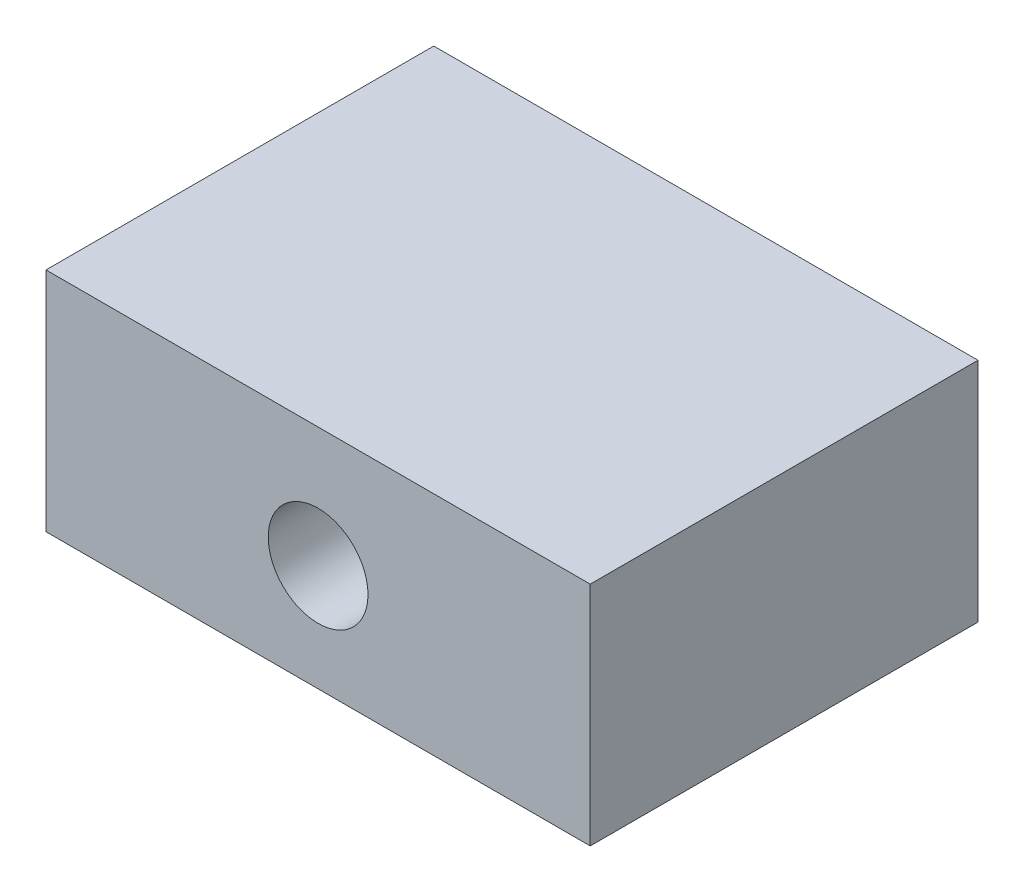
from build123d import *

# Parameters (mm, degrees)
SZKIC1_W                    = 12
SZKIC1_H                    = 5
DODANIE_WYCI_GNI_CIE1_DEPTH = 8.55
SZKIC2_R                    = 1.1
WYTNIJ_WYCI_GNI_CIE1_DEPTH  = 11.740228117


with BuildPart() as part:
    # Szkic1 → Dodanie-wyciągnięcie1 (new body)
    with BuildSketch(Plane.XY):
        Rectangle(SZKIC1_W, SZKIC1_H)
    extrude(amount=DODANIE_WYCI_GNI_CIE1_DEPTH)

    # Szkic2 → Wytnij-wyciągnięcie1 (cut, through all)
    with BuildSketch(Plane.XY.offset(8.55)):
        with Locations((0, -0.15)):
            Circle(SZKIC2_R)
    extrude(amount=-WYTNIJ_WYCI_GNI_CIE1_DEPTH, mode=Mode.SUBTRACT)


solid = part.part
